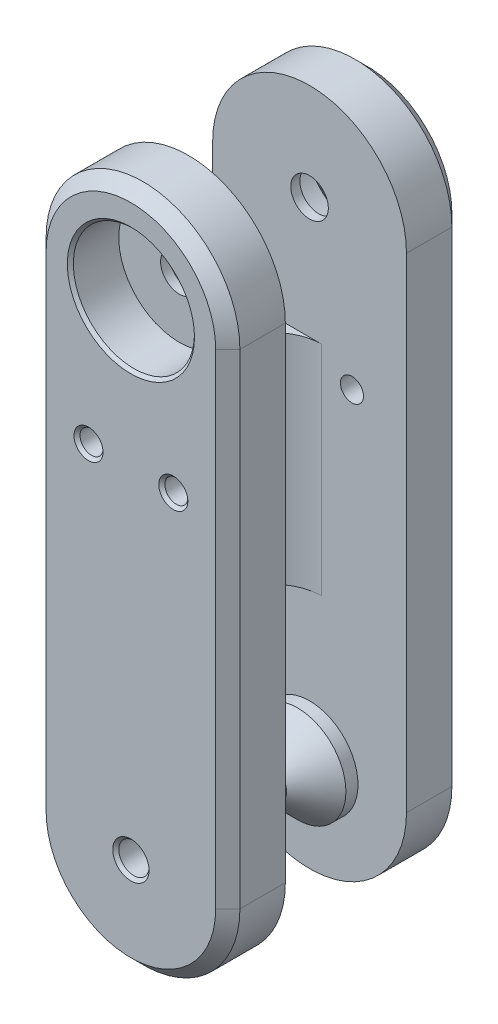
from build123d import *

# Parameters (mm, degrees)
SKETCH1_R           = 1.55
SKETCH1_R_2         = 1.25
BOSS_EXTRUDE1_DEPTH = 4.75
FILLET2_SIZE        = 1
SKETCH2_R           = 5
CUT_EXTRUDE1_DEPTH  = 4
SKETCH3_W           = 5
SKETCH3_H           = 18
BOSS_EXTRUDE2_DEPTH = 5
SKETCH8_R           = 4
SKETCH8_R_2         = 1.55
BOSS_EXTRUDE4_DEPTH = 4
FILLET3_R           = 4
SKETCH7_R           = 0.95
CUT_EXTRUDE3_DEPTH  = 53.423754158
CHAFL_N1_SIZE       = 0.25
CHAFL_N2_SIZE       = 3


with BuildPart() as part:
    # Sketch1 → Boss-Extrude1 (new body)
    with BuildSketch(Plane.XY):
        with BuildLine():
            Line((-8, 0), (-8, 40))
            ThreePointArc((-8, 40), (0, 48), (8, 40))
            Line((8, 40), (8, 0))
            ThreePointArc((8, 0), (0, -8), (-8, 0))
        make_face()
        with Locations((0, 40)):
            Circle(SKETCH1_R, mode=Mode.SUBTRACT)
        Circle(SKETCH1_R_2, mode=Mode.SUBTRACT)
    extrude(amount=BOSS_EXTRUDE1_DEPTH)

    # Fillet2
    fillet2_edges = [part.edges().sort_by_distance(p)[0] for p in [
        (0, 48, 4.75),
        (-8, 20, 4.75),
        (0, -8, 4.75),
        (8, 20, 4.75),
    ]]
    chamfer(fillet2_edges, length=FILLET2_SIZE)

    # Sketch2 → Cut-Extrude1 (cut)
    with BuildSketch(Plane.XY.offset(4.75)):
        with Locations((0, 40)):
            Circle(SKETCH2_R)
    extrude(amount=-CUT_EXTRUDE1_DEPTH, mode=Mode.SUBTRACT)

    # Sketch3 → Boss-Extrude2 (add)
    with BuildSketch(Plane(origin=(0, 0, 0), x_dir=(-1, 0, 0), z_dir=(0, 0, -1))):
        with Locations((5.5, 21)):
            Rectangle(SKETCH3_W, SKETCH3_H)
    extrude(amount=BOSS_EXTRUDE2_DEPTH)

    # Sketch8 → Boss-Extrude4 (add)
    with BuildSketch(Plane(origin=(0, 0, 0), x_dir=(-1, 0, 0), z_dir=(0, 0, -1))):
        with Locations(Location((0, 0, 0), (0, 0, 180))):
            Circle(SKETCH8_R)
        Circle(SKETCH8_R_2, mode=Mode.SUBTRACT)
    extrude(amount=BOSS_EXTRUDE4_DEPTH)

    # Fillet3
    fillet3_edges = [part.edges().sort_by_distance(p)[0] for p in [
        (-3, 21, 0),
    ]]
    fillet(fillet3_edges, radius=FILLET3_R)

    # Mirror5: part across plane


with BuildPart() as part_1:
    add(part.part)
    add(part.part.mirror(Plane.XY.offset(-5)))

    # Sketch7 → Cut-Extrude3 (cut, through all)
    with BuildSketch(Plane(origin=(0, 0, -14.75), x_dir=(-1, 0, 0), z_dir=(0, 0, -1))):
        with Locations((-3.5, 28)):
            Circle(SKETCH7_R)
        with Locations(Location((3.5, 28, 0), (0, 0, 180))):
            Circle(SKETCH7_R)
    extrude(amount=-CUT_EXTRUDE3_DEPTH, mode=Mode.SUBTRACT)

    # Chaflán1
    chafl_n1_edges = [part_1.edges().sort_by_distance(p)[0] for p in [
        (4.45, 28, 4.75),
        (4.45, 28, -14.75),
        (-4.45, 28, 4.75),
        (-4.45, 28, -14.75),
        (-1.25, 0, 4.75),
        (-5, 40, 4.75),
        (-5, 40, -14.75),
        (-1.25, 0, -14.75),
    ]]
    chamfer(chafl_n1_edges, length=CHAFL_N1_SIZE)

    # Chaflán2
    # the kernel refuses this chamfer: 3 mm, written as the material it takes off along each edge
    with BuildSketch(Plane(origin=(0, 0, -6), x_dir=(1, 0, 0), z_dir=(0, 1, 0))) as chafl_n2_piece_1:
        Polygon((4, CHAFL_N2_SIZE), (4 - CHAFL_N2_SIZE, 0), (4, 0), align=None)
    revolve(axis=Axis((0, 0, -6), (0, 0, -1)), mode=Mode.SUBTRACT)
    with BuildSketch(Plane(origin=(0, 0, -4), x_dir=(1, 0, 0), z_dir=(0, 1, 0))) as chafl_n2_piece_2:
        Polygon((4, -CHAFL_N2_SIZE), (4 - CHAFL_N2_SIZE, 0), (4, 0), align=None)
    revolve(axis=Axis((0, 0, -4), (0, 0, -1)), mode=Mode.SUBTRACT)


solid = part_1.part
